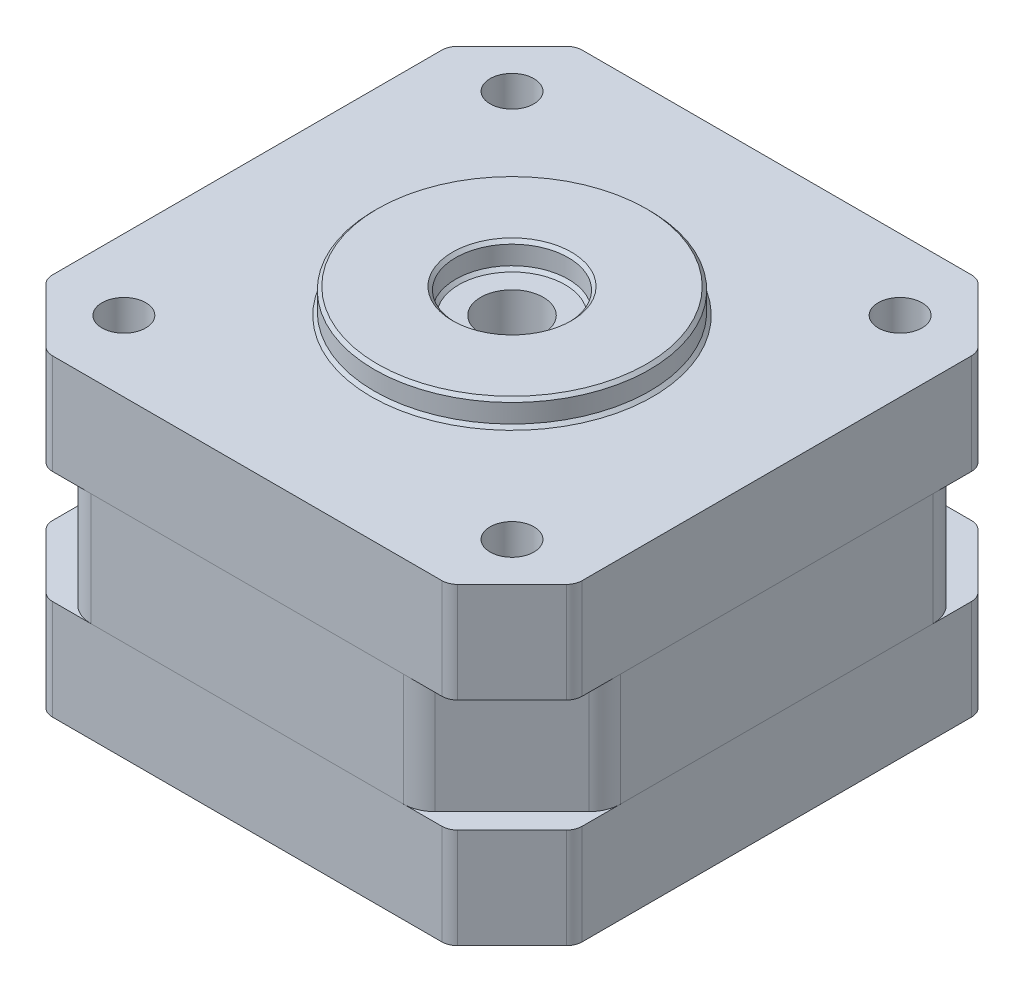
from build123d import *

# Parameters (mm, degrees)
SKETCH1_W           = 42.3
SKETCH1_H           = 42.3
BOSS_EXTRUDE1_DEPTH = 8.001
CHAMFER1_SIZE       = 5.08
SKETCH2_W           = 42.3
SKETCH2_H           = 42.3
BOSS_EXTRUDE2_DEPTH = 8.9916
CHAMFER3_SIZE       = 7.62
FILLET1_R           = 2.54
FILLET2_R           = 1.27
SKETCH3_W           = 42.3
SKETCH3_H           = 42.3
BOSS_EXTRUDE3_DEPTH = 8.001
CHAMFER4_SIZE       = 5.08
FILLET3_R           = 1.27
SKETCH4_R           = 10.9982
SKETCH4_R_2         = 4.4958
BOSS_EXTRUDE4_DEPTH = 2
CHAMFER5_SIZE       = 0.254
SKETCH5_R           = 2.5019
CUT_EXTRUDE1_DEPTH  = 12.7
SKETCH6_R           = 1.75
CUT_EXTRUDE2_DEPTH  = 39.978520251


with BuildPart() as part:
    # Sketch1 → Boss-Extrude1 (new body)
    with BuildSketch(Plane(origin=(0, 0, 0), x_dir=(1, 0, 0), z_dir=(0, 1, 0))):
        Rectangle(SKETCH1_W, SKETCH1_H)
    extrude(amount=BOSS_EXTRUDE1_DEPTH)

    # Chamfer1
    chamfer1_edges = [part.edges().sort_by_distance(p)[0] for p in [
        (-21.15, 4.0005, 21.15),
        (-21.15, 4.0005, -21.15),
        (21.15, 4.0005, -21.15),
        (21.15, 4.0005, 21.15),
    ]]
    chamfer(chamfer1_edges, length=CHAMFER1_SIZE)

    # Fillet2
    fillet2_edges = [part.edges().sort_by_distance(p)[0] for p in [
        (-21.15, 4.0005, -16.07),
        (-16.07, 4.0005, -21.15),
        (16.07, 4.0005, -21.15),
        (21.15, 4.0005, -16.07),
        (21.15, 4.0005, 16.07),
        (16.07, 4.0005, 21.15),
        (-16.07, 4.0005, 21.15),
        (-21.15, 4.0005, 16.07),
    ]]
    fillet(fillet2_edges, radius=FILLET2_R)


with BuildPart() as body_2:
    # Sketch2 → Boss-Extrude2 (new body)
    with BuildSketch(Plane(origin=(0, 8.001, 0), x_dir=(1, 0, 0), z_dir=(0, 1, 0))):
        Rectangle(SKETCH2_W, SKETCH2_H)
    extrude(amount=BOSS_EXTRUDE2_DEPTH)

    # Chamfer3
    chamfer3_edges = [body_2.edges().sort_by_distance(p)[0] for p in [
        (-21.15, 12.4968, -21.15),
        (-21.15, 12.4968, 21.15),
        (21.15, 12.4968, 21.15),
        (21.15, 12.4968, -21.15),
    ]]
    chamfer(chamfer3_edges, length=CHAMFER3_SIZE)

    # Fillet1
    fillet1_edges = [body_2.edges().sort_by_distance(p)[0] for p in [
        (-21.15, 12.4968, -13.53),
        (-13.53, 12.4968, -21.15),
        (13.53, 12.4968, -21.15),
        (21.15, 12.4968, -13.53),
        (21.15, 12.4968, 13.53),
        (13.53, 12.4968, 21.15),
        (-13.53, 12.4968, 21.15),
        (-21.15, 12.4968, 13.53),
    ]]
    fillet(fillet1_edges, radius=FILLET1_R)


with BuildPart() as body_3:
    # Sketch3 → Boss-Extrude3 (new body)
    with BuildSketch(Plane(origin=(0, 16.9926, 0), x_dir=(1, 0, 0), z_dir=(0, 1, 0))):
        Rectangle(SKETCH3_W, SKETCH3_H)
    extrude(amount=BOSS_EXTRUDE3_DEPTH)

    # Chamfer4
    chamfer4_edges = [body_3.edges().sort_by_distance(p)[0] for p in [
        (-21.15, 20.9931, 21.15),
        (-21.15, 20.9931, -21.15),
        (21.15, 20.9931, -21.15),
        (21.15, 20.9931, 21.15),
    ]]
    chamfer(chamfer4_edges, length=CHAMFER4_SIZE)

    # Fillet3
    fillet3_edges = [body_3.edges().sort_by_distance(p)[0] for p in [
        (-21.15, 20.9931, -16.07),
        (-16.07, 20.9931, -21.15),
        (16.07, 20.9931, -21.15),
        (21.15, 20.9931, -16.07),
        (21.15, 20.9931, 16.07),
        (16.07, 20.9931, 21.15),
        (-16.07, 20.9931, 21.15),
        (-21.15, 20.9931, 16.07),
    ]]
    fillet(fillet3_edges, radius=FILLET3_R)

    # Sketch4 → Boss-Extrude4 (add)
    with BuildSketch(Plane(origin=(0, 24.9936, 0), x_dir=(1, 0, 0), z_dir=(0, 1, 0))):
        Circle(SKETCH4_R)
        Circle(SKETCH4_R_2, mode=Mode.SUBTRACT)
    extrude(amount=BOSS_EXTRUDE4_DEPTH)

    # Chamfer5
    chamfer5_edges = [body_3.edges().sort_by_distance(p)[0] for p in [
        (-10.9982, 26.9936, 0),
        (-10.9982, 24.9936, 0),
        (-4.4958, 24.9936, 0),
        (-4.4958, 26.9936, 0),
    ]]
    chamfer(chamfer5_edges, length=CHAMFER5_SIZE)


with BuildPart() as cut_extrude1_tool:
    # Sketch5 → Cut-Extrude1 (new body)
    with BuildSketch(Plane(origin=(0, 24.9936, 0), x_dir=(1, 0, 0), z_dir=(0, 1, 0))):
        Circle(SKETCH5_R)
    extrude(amount=-CUT_EXTRUDE1_DEPTH)


with BuildPart() as body_2_1:
    add(body_2.part)

    # Cut-Extrude1: cut by cut_extrude1_tool
    add(cut_extrude1_tool.part, mode=Mode.SUBTRACT)


with BuildPart() as body_3_1:
    add(body_3.part)

    # Cut-Extrude1: cut by cut_extrude1_tool
    add(cut_extrude1_tool.part, mode=Mode.SUBTRACT)


with BuildPart() as cut_extrude2_tool:
    # Sketch6 → Cut-Extrude2 (new, through all)
    with BuildSketch(Plane(origin=(0, 24.9936, 0), x_dir=(1, 0, 0), z_dir=(0, 1, 0))):
        with Locations((15.5, -15.5)):
            Circle(SKETCH6_R)
        with Locations((-15.499999976, -15.5)):
            Circle(SKETCH6_R)
        with Locations((-15.499999976, 15.499999976)):
            Circle(SKETCH6_R)
        with Locations((15.5, 15.499999976)):
            Circle(SKETCH6_R)
    extrude(amount=-CUT_EXTRUDE2_DEPTH)


with BuildPart() as part_1:
    add(part.part)

    # Cut-Extrude2: cut by cut_extrude2_tool
    add(cut_extrude2_tool.part, mode=Mode.SUBTRACT)


with BuildPart() as body_2_2:
    add(body_2_1.part)

    # Cut-Extrude2: cut by cut_extrude2_tool
    add(cut_extrude2_tool.part, mode=Mode.SUBTRACT)


with BuildPart() as body_3_2:
    add(body_3_1.part)

    # Cut-Extrude2: cut by cut_extrude2_tool
    add(cut_extrude2_tool.part, mode=Mode.SUBTRACT)


solid = Compound([part_1.part, body_2_2.part, body_3_2.part])
